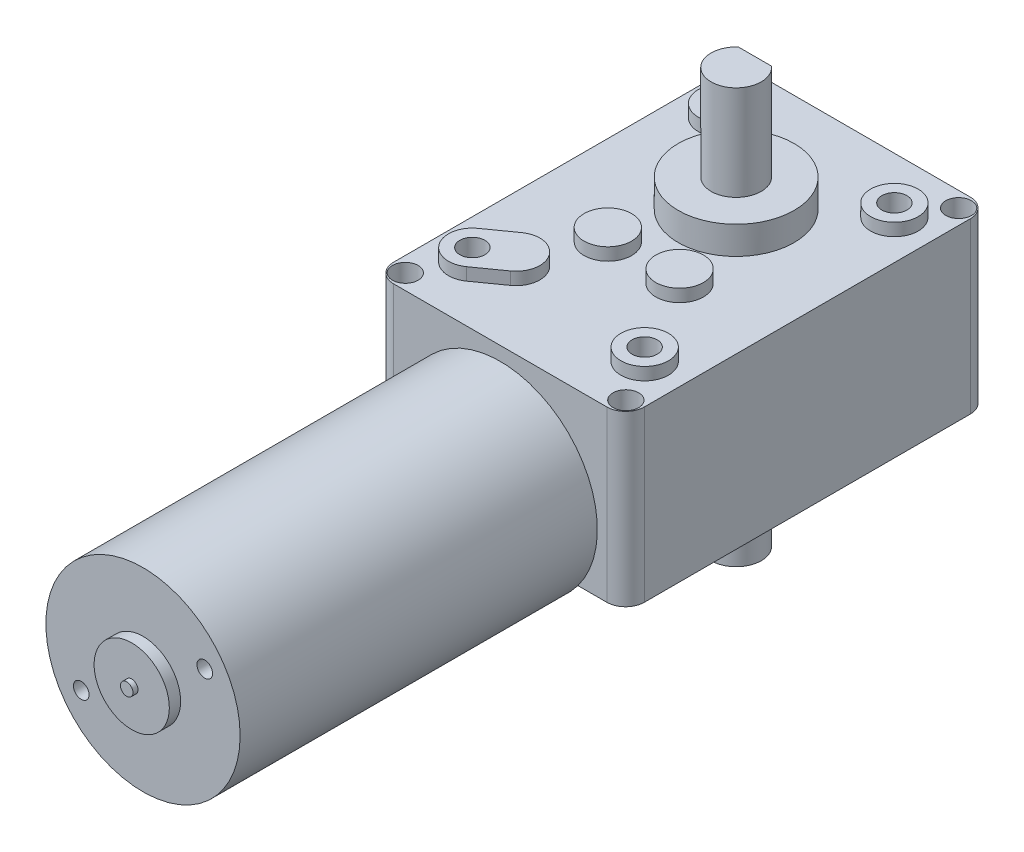
from build123d import *

# Parameters (mm, degrees)
BOSS_EXTRUDE2_DEPTH = 27
SKETCH5_R           = 3.8
BOSS_EXTRUDE3_DEPTH = 2
SKETCH6_R           = 2
CUT_EXTRUDE3_DEPTH  = 4
SKETCH7_R           = 9.25
BOSS_EXTRUDE4_DEPTH = 4.45
SKETCH8_R           = 4
BOSS_EXTRUDE5_DEPTH = 15.14
CUT_EXTRUDE4_START  = -13
CUT_EXTRUDE4_DEPTH  = 13
SKETCH11_R          = 15.5
BOSS_EXTRUDE6_DEPTH = 57
SKETCH12_R          = 6
BOSS_EXTRUDE7_DEPTH = 1.8
SKETCH13_R          = 1
BOSS_EXTRUDE8_DEPTH = 0.8
SKETCH14_R          = 1.25
CUT_EXTRUDE6_DEPTH  = 4
SKETCH10_R          = 2.05
CUT_EXTRUDE5_DEPTH  = 4


with BuildPart() as part:
    # Sketch1 → Boss-Extrude2 (new body)
    with BuildSketch(Plane(origin=(0, 0, 0), x_dir=(1, 0, 0), z_dir=(0, 1, 0))):
        with BuildLine():
            Line((17.005, -29), (-17.005, -29))
            ThreePointArc((-17.005, -29), (-19.126320344, -28.121320344), (-20.005, -26))
            Line((-20.005, -26), (-20.005, 26))
            ThreePointArc((-20.005, 26), (-19.126320344, 28.121320344), (-17.005, 29))
            Line((-17.005, 29), (17.005, 29))
            ThreePointArc((17.005, 29), (19.126320344, 28.121320344), (20.005, 26))
            Line((20.005, 26), (20.005, -26))
            ThreePointArc((20.005, -26), (19.126320344, -28.121320344), (17.005, -29))
        make_face()
    extrude(amount=BOSS_EXTRUDE2_DEPTH)

    # Sketch5 → Boss-Extrude3 (add)
    with BuildSketch(Plane(origin=(0, 27, 0), x_dir=(1, 0, 0), z_dir=(0, 1, 0))):
        with Locations((-13.75, 20.15)):
            Circle(SKETCH5_R)
        with Locations((13.75, 20.15)):
            Circle(SKETCH5_R)
        with Locations((13.75, -19.7)):
            Circle(SKETCH5_R)
        with Locations((-5.725, -6.1)):
            Circle(SKETCH5_R)
        with Locations((5.725, -6.1)):
            Circle(SKETCH5_R)
        with BuildLine():
            Line((-15.954, -16.604457398), (-11.880917629, -13.704457398))
            ThreePointArc((-11.880917629, -13.704457398), (-6.581375027, -14.596), (-7.472917629, -19.895542602))
            Line((-7.472917629, -19.895542602), (-11.546, -22.795542602))
            ThreePointArc((-11.546, -22.795542602), (-16.845542602, -21.904), (-15.954, -16.604457398))
        make_face()
    boss_extrude3 = extrude(amount=BOSS_EXTRUDE3_DEPTH)

    # Sketch6 → Cut-Extrude3 (cut)
    with BuildSketch(Plane(origin=(0, 29, 0), x_dir=(1, 0, 0), z_dir=(0, 1, 0))):
        with Locations((13.75, -19.7)):
            Circle(SKETCH6_R)
        with Locations((13.75, 20.15)):
            Circle(SKETCH6_R)
        with Locations((-13.75, 20.15)):
            Circle(SKETCH6_R)
        with Locations((-13.75, -19.7)):
            Circle(SKETCH6_R)
    cut_extrude3 = extrude(amount=-CUT_EXTRUDE3_DEPTH, mode=Mode.SUBTRACT)

    # Sketch7 → Boss-Extrude4 (add)
    with BuildSketch(Plane(origin=(0, 27, 0), x_dir=(1, 0, 0), z_dir=(0, 1, 0))):
        with Locations((0, 8.65)):
            Circle(SKETCH7_R)
    boss_extrude4 = extrude(amount=BOSS_EXTRUDE4_DEPTH)

    # Sketch8 → Boss-Extrude5 (add)
    with BuildSketch(Plane(origin=(0, 31.45, 0), x_dir=(1, 0, 0), z_dir=(0, 1, 0))):
        with Locations((0, 8.65)):
            Circle(SKETCH8_R)
    boss_extrude5 = extrude(amount=BOSS_EXTRUDE5_DEPTH)

    # Sketch9 → Cut-Extrude4 (cut)
    with BuildSketch(Plane(origin=(0, 46.59, 0), x_dir=(1, 0, 0), z_dir=(0, 1, 0)).offset(CUT_EXTRUDE4_START)):
        with BuildLine():
            Line((-2.645751311, 11.65), (2.645751311, 11.65))
            ThreePointArc((2.645751311, 11.65), (0, 12.65), (-2.645751311, 11.65))
        make_face()
    cut_extrude4 = extrude(amount=CUT_EXTRUDE4_DEPTH, mode=Mode.SUBTRACT)

    # Mirror1: Boss-Extrude3, Cut-Extrude3, Boss-Extrude4, Boss-Extrude5, Cut-Extrude4 across plane
    add(boss_extrude3.mirror(Plane.ZX.offset(13.5)))
    add(cut_extrude3.mirror(Plane.ZX.offset(13.5)), mode=Mode.SUBTRACT)
    add(boss_extrude4.mirror(Plane.ZX.offset(13.5)))
    add(boss_extrude5.mirror(Plane.ZX.offset(13.5)))
    add(cut_extrude4.mirror(Plane.ZX.offset(13.5)), mode=Mode.SUBTRACT)

    # Sketch11 → Boss-Extrude6 (add)
    with BuildSketch(Plane.XY.offset(29)):
        with Locations((0, 9.3)):
            Circle(SKETCH11_R)
    extrude(amount=BOSS_EXTRUDE6_DEPTH)

    # Sketch12 → Boss-Extrude7 (add)
    with BuildSketch(Plane.XY.offset(86)):
        with Locations((0, 9.3)):
            Circle(SKETCH12_R)
    extrude(amount=BOSS_EXTRUDE7_DEPTH)

    # Sketch13 → Boss-Extrude8 (add)
    with BuildSketch(Plane.XY.offset(87.8)):
        with Locations((0, 9.3)):
            Circle(SKETCH13_R)
    extrude(amount=BOSS_EXTRUDE8_DEPTH)

    # Sketch14 → Cut-Extrude6 (cut)
    with BuildSketch(Plane.XY.offset(86)):
        with Locations((9.854379173, 15.699508661)):
            Circle(SKETCH14_R)
        with Locations((-9.854379173, 2.900491339)):
            Circle(SKETCH14_R)
    extrude(amount=-CUT_EXTRUDE6_DEPTH, mode=Mode.SUBTRACT)

    # Sketch10 → Cut-Extrude5 (cut)
    with BuildSketch(Plane(origin=(0, 27, 0), x_dir=(1, 0, 0), z_dir=(0, 1, 0))):
        with Locations((-17.6, 26.55)):
            Circle(SKETCH10_R)
        with Locations((17.6, 26.55)):
            Circle(SKETCH10_R)
        with Locations((17.6, -26.55)):
            Circle(SKETCH10_R)
        with Locations((-17.6, -26.55)):
            Circle(SKETCH10_R)
    extrude(amount=-CUT_EXTRUDE5_DEPTH, mode=Mode.SUBTRACT)


solid = part.part
